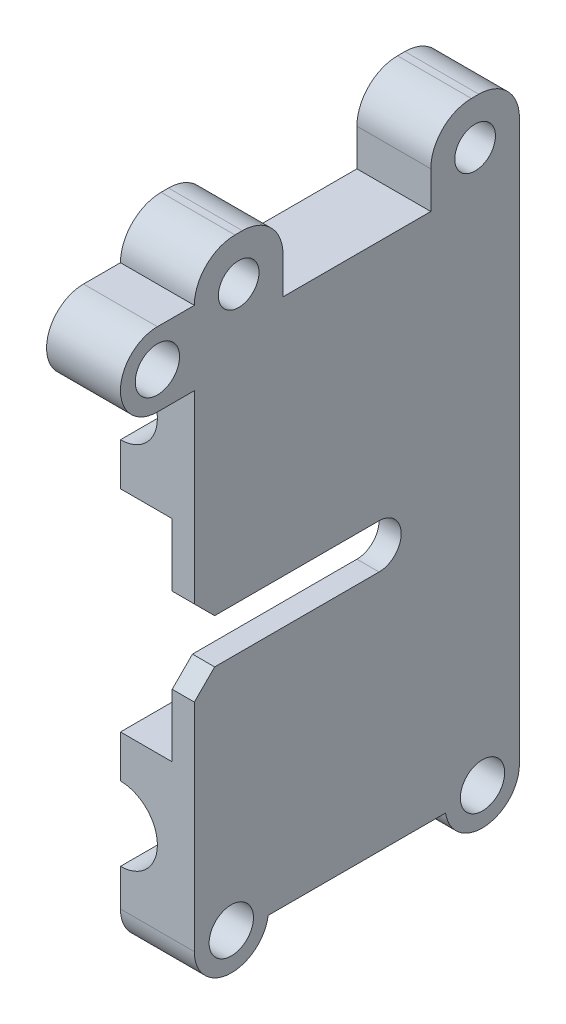
from build123d import *
from build123d.topology import SkipClean

# Parameters (mm, degrees)
SKETCH1_W                = 44
SKETCH1_H                = 32
BOSS_EXTRUDE1_DEPTH      = 12
SKETCH2_W                = 24.5
SKETCH2_H                = 15.5
CUT_EXTRUDE1_DEPTH       = 7.75
FILLET1_R                = 7.75
CUT_EXTRUDE2_DEPTH       = 40.661851949
CUT_EXTRUDE2_DEPTH_BACK  = 40.661851949
SKETCH4_R                = 2.75
SKETCH4_W                = 20
SKETCH4_H                = 10.5
CUT_EXTRUDE3_DEPTH       = 30.732137495
SKETCH5_W                = 5.5
SKETCH5_H                = 3
BOSS_EXTRUDE4_DEPTH      = 7
CHAMFER1_SIZE            = 7
SKETCH6_W                = 11.5
SKETCH6_H                = 7
CUT_EXTRUDE5_DEPTH       = 30.732137495
FILLET4_R                = 5.5
SKETCH10_W               = 3
SKETCH10_H               = 44
BOSS_EXTRUDE6_DEPTH      = 28.5
SKETCH11_W               = 10
SKETCH11_H               = 44
BOSS_EXTRUDE7_DEPTH      = 21.5
SKETCH12_W               = 24.5
SKETCH12_H               = 15.5
CUT_EXTRUDE8_DEPTH       = 7.75
FILLET6_R                = 7.75
CUT_EXTRUDE9_DEPTH       = 82.565924258
SKETCH14_W               = 16
SKETCH14_H               = 20
BOSS_EXTRUDE8_DEPTH      = 13.5
CUT_EXTRUDE10_DEPTH      = 10
FILLET7_R                = 2
SKETCH16_R               = 1.75
CUT_EXTRUDE11_DEPTH      = 72.275872496
CUT_EXTRUDE12_START      = -3
SKETCH17_R               = 1.75
CUT_EXTRUDE12_DEPTH      = 3
SKETCH18_W               = 44
SKETCH18_H               = 3
BOSS_EXTRUDE9_DEPTH      = 10
CUT_EXTRUDE13_REACH      = 76.096
SKETCH20_W               = 11
SKETCH20_H               = 9
SKETCH21_R               = 1.75
CUT_EXTRUDE14_DEPTH      = 5
SKETCH22_R               = 1.75
CUT_EXTRUDE15_DEPTH      = 2
SKETCH23_W               = 28
SKETCH23_H               = 6
CUT_EXTRUDE16_DEPTH      = 71.867834735
FILLET8_R                = 3
CHAMFER2_SIZE            = 2.75
CHAMFER3_SIZE            = 3
FILLET9_R                = 3
SKETCH25_W               = 10
SKETCH25_H               = 10
BOSS_EXTRUDE12_DEPTH     = 5
FILLET11_R               = 5
SKETCH26_W               = 10
SKETCH26_H               = 4.25
BOSS_EXTRUDE13_DEPTH     = 5
CUT_EXTRUDE17_DEPTH      = 80.498820746
CUT_EXTRUDE17_DEPTH_BACK = 80.498820746
SKETCH27_R               = 1.75
FILLET15_R               = 5
CUT_EXTRUDE20_DEPTH      = 80.498820746
CUT_EXTRUDE20_DEPTH_BACK = 80.498820746
SKETCH29_R               = 1.75
FILLET17_R               = 5.5
BOSS_EXTRUDE14_DEPTH     = 6
CHAMFER11_SIZE           = 7
SKETCH35_R               = 3
SKETCH35_R_2             = 1.75
CUT_EXTRUDE25_DEPTH      = 79.454206388
SKETCH36_W               = 132.801714395
SKETCH36_H               = 170.132581229
CUT_EXTRUDE26_DEPTH      = 79.938662897
CUT_EXTRUDE27_OUTLINE_R  = 1.75
CUT_EXTRUDE27_DEPTH      = 13.5
SKETCH38_W               = 16
SKETCH38_H               = 28.5
BOSS_EXTRUDE16_DEPTH     = 3
SKETCH39_R               = 1.75
BOSS_EXTRUDE18_DEPTH     = 5
CUT_EXTRUDE28_START      = -7
SKETCH40_R               = 3
SKETCH40_R_2             = 1.75
CUT_EXTRUDE28_DEPTH      = 7


# Read off the part's stored shape, not the designer's step: Cut-Extrude27
# Some blends are built 0.0001 mm under size
with BuildPart() as part:
    # Sketch1 → Boss-Extrude1 (new body)
    with BuildSketch(Plane(origin=(0, 0, 0), x_dir=(0, 0, -1), z_dir=(1, 0, 0))):
        Rectangle(SKETCH1_W, SKETCH1_H)
    extrude(amount=BOSS_EXTRUDE1_DEPTH)

    # Sketch2 → Cut-Extrude1 (cut)
    with BuildSketch(Plane(origin=(0, 0, 0), x_dir=(0, 0, -1), z_dir=(1, 0, 0))):
        with Locations((0, -5.25)):
            Rectangle(SKETCH2_W, SKETCH2_H)
    extrude(amount=CUT_EXTRUDE1_DEPTH, mode=Mode.SUBTRACT)

    # Fillet1
    fillet1_edges = [part.edges().sort_by_distance(p)[0] for p in [
        (7.75, 2.5, 0),
        (7.75, -13, 0),
    ]]
    fillet(fillet1_edges, radius=FILLET1_R - 0.0001)  # a hair under: the kernel refuses the full size

    # Sketch3 → Cut-Extrude2 (cut, two sides: drawn at the far end of the back side and taken through both)
    with BuildSketch(Plane.XY.offset(-12.25).offset(-CUT_EXTRUDE2_DEPTH_BACK)):
        with BuildLine():
            ThreePointArc((0, -10.25), (3.535533906, -8.785533906), (5, -5.25))
            ThreePointArc((5, -5.25), (3.535533906, -1.714466094), (0, -0.25))
            Line((0, -0.25), (0, -10.25))
        make_face()
        with BuildLine():
            Line((0, -10.25), (0, -0.25))
            ThreePointArc((0, -0.25), (-5, -5.25), (0, -10.25))
        make_face()
    extrude(amount=CUT_EXTRUDE2_DEPTH + CUT_EXTRUDE2_DEPTH_BACK, mode=Mode.SUBTRACT)

    # Sketch4 → Cut-Extrude3 (cut, through all)
    with BuildSketch(Plane(origin=(12, 0, 0), x_dir=(0, 0, -1), z_dir=(1, 0, 0))):
        with Locations((-16, 10)):
            Circle(SKETCH4_R)
        with Locations((16, 10)):
            Circle(SKETCH4_R)
        with Locations((0, 10.75)):
            Rectangle(SKETCH4_W, SKETCH4_H)
    extrude(amount=-CUT_EXTRUDE3_DEPTH, mode=Mode.SUBTRACT)

    # Sketch5 → Boss-Extrude4 (add)
    with BuildSketch(Plane(origin=(12, 0, 0), x_dir=(0, 0, -1), z_dir=(1, 0, 0))):
        Polygon((-16, -3), (-16, 4.5), (-2.75, -3), align=None)
        Polygon((-2.75, -3), (-16, 4.5), (-2.75, 0), align=None)
        with Locations((0, -1.5)):
            Rectangle(SKETCH5_W, SKETCH5_H)
        Polygon((2.75, -3), (2.75, 0), (16, 4.5), align=None)
        Polygon((16, -3), (2.75, -3), (16, 4.5), align=None)
    extrude(amount=BOSS_EXTRUDE4_DEPTH)

    # Chamfer1
    chamfer1_edges = [part.edges().sort_by_distance(p)[0] for p in [
        (12, -3, 0),
    ]]
    chamfer(chamfer1_edges, length=CHAMFER1_SIZE - 0.0001)  # a hair under: the kernel refuses the full size

    # Sketch6 → Cut-Extrude5 (cut, through all)
    with BuildSketch(Plane(origin=(12, 0, 0), x_dir=(0, 0, -1), z_dir=(1, 0, 0))):
        with Locations((-7.25, -6.5)):
            Rectangle(SKETCH6_W, SKETCH6_H)
        with Locations((7.25, -6.5)):
            Rectangle(SKETCH6_W, SKETCH6_H)
    extrude(amount=CUT_EXTRUDE5_DEPTH, mode=Mode.SUBTRACT)

    # Fillet4
    fillet4_edges = [part.edges().sort_by_distance(p)[0] for p in [
        (6, 16, 22),
        (6, 16, -22),
    ]]
    fillet(fillet4_edges, radius=FILLET4_R)

    # Sketch10 → Boss-Extrude6 (add)
    with BuildSketch(Plane.XZ.offset(16)):
        with Locations((8.5, 0)):
            Rectangle(SKETCH10_W, SKETCH10_H)
    extrude(amount=BOSS_EXTRUDE6_DEPTH)

    # Sketch11 → Boss-Extrude7 (add)
    with BuildSketch(Plane.XZ.offset(44.5)):
        with Locations((5, 0)):
            Rectangle(SKETCH11_W, SKETCH11_H)
    extrude(amount=BOSS_EXTRUDE7_DEPTH)

    # Sketch12 → Cut-Extrude8 (cut)
    with BuildSketch(Plane.ZY):
        with Locations((0, -55.25)):
            Rectangle(SKETCH12_W, SKETCH12_H)
    extrude(amount=-CUT_EXTRUDE8_DEPTH, mode=Mode.SUBTRACT)

    # Fillet6
    fillet6_edges = [part.edges().sort_by_distance(p)[0] for p in [
        (7.75, -63, 0),
        (7.75, -47.5, 0),
    ]]
    fillet(fillet6_edges, radius=FILLET6_R - 0.0001)  # a hair under: the kernel refuses the full size

    # Sketch13 → Cut-Extrude9 (cut, through all)
    with BuildSketch(Plane.XY.offset(22)):
        with BuildLine():
            ThreePointArc((0, -60.25), (3.535533906, -58.785533906), (5, -55.25))
            ThreePointArc((5, -55.25), (3.535533906, -51.714466094), (0, -50.25))
            Line((0, -50.25), (0, -60.25))
        make_face()
        with BuildLine():
            Line((0, -60.25), (0, -50.25))
            ThreePointArc((0, -50.25), (-5, -55.25), (0, -60.25))
        make_face()
    extrude(amount=-CUT_EXTRUDE9_DEPTH, mode=Mode.SUBTRACT)

    # Sketch14 → Boss-Extrude8 (add)
    with BuildSketch(Plane.ZY.offset(-7)):
        with Locations((-14, -26)):
            Rectangle(SKETCH14_W, SKETCH14_H)
    extrude(amount=BOSS_EXTRUDE8_DEPTH)

    # Sketch15 → Cut-Extrude10 (cut)
    with BuildSketch(Plane.ZY.offset(6.5)):
        with BuildLine():
            Line((-13.727178029, -29), (-22, -29))
            Line((-22, -29), (-22, -31.5))
            Line((-22, -31.5), (-13.727178029, -31.5))
            ThreePointArc((-13.727178029, -31.5), (-14, -30.25), (-13.727178029, -29))
        make_face()
        with BuildLine():
            ThreePointArc((-8, -30.25), (-10.360286817, -27.318998969), (-13.727178029, -29))
            Line((-13.727178029, -29), (-11, -29))
            Line((-11, -29), (-11, -31.5))
            Line((-11, -31.5), (-13.727178029, -31.5))
            ThreePointArc((-13.727178029, -31.5), (-10.360286817, -33.181001031), (-8, -30.25))
        make_face()
        with BuildLine():
            Line((-11, -29), (-13.727178029, -29))
            ThreePointArc((-13.727178029, -29), (-14, -30.25), (-13.727178029, -31.5))
            Line((-13.727178029, -31.5), (-11, -31.5))
            Line((-11, -31.5), (-11, -29))
        make_face()
    extrude(amount=-CUT_EXTRUDE10_DEPTH, mode=Mode.SUBTRACT)

    # Fillet7
    fillet7_edges = [part.edges().sort_by_distance(p)[0] for p in [
        (-1.5, -31.5, -13.727178029),
        (-1.5, -29, -13.727178029),
    ]]
    fillet(fillet7_edges, radius=FILLET7_R)

    # Sketch16 → Cut-Extrude11 (cut, through all)
    with BuildSketch(Plane.ZY.offset(-3.5)):
        with Locations((-11, -30.25)):
            Circle(SKETCH16_R)
    extrude(amount=-CUT_EXTRUDE11_DEPTH, mode=Mode.SUBTRACT)

    # Sketch17 → Cut-Extrude12 (cut)
    with BuildSketch(Plane(origin=(10, 0, 0), x_dir=(0, 0, -1), z_dir=(1, 0, 0)).offset(CUT_EXTRUDE12_START)):
        Polygon((14.175426481, -30.25), (12.58771324, -27.5), (9.41228676, -27.5), (7.824573519, -30.25), (9.41228676, -33), (12.58771324, -33), align=None)
        with Locations(Location((11, -30.25, 0), (0, 0, 180))):
            Circle(SKETCH17_R, mode=Mode.SUBTRACT)
    extrude(amount=CUT_EXTRUDE12_DEPTH, mode=Mode.SUBTRACT)

    # Sketch18 → Boss-Extrude9 (add)
    with BuildSketch(Plane.ZY.offset(-7)):
        with Locations((0, -37.5)):
            Rectangle(SKETCH18_W, SKETCH18_H)
    extrude(amount=BOSS_EXTRUDE9_DEPTH)

    # Cut-Extrude13: up to this face of the body (flat: up to its plane)
    cut_extrude13_end = Plane(part.part.faces().sort_by_distance((7, -26, 8))[0])
    # Sketch20 → Cut-Extrude13 (cut, up to the picked face)
    with BuildSketch(Plane.ZY.offset(6.5), mode=Mode.PRIVATE) as cut_extrude13_sk1:
        with Locations((-16.5, -20.5)):
            Rectangle(SKETCH20_W, SKETCH20_H)
    cut_extrude13_tool1 = split(extrude(cut_extrude13_sk1.sketch, amount=-CUT_EXTRUDE13_REACH, mode=Mode.PRIVATE), bisect_by=cut_extrude13_end, keep=Keep.BOTH, mode=Mode.PRIVATE)
    add(cut_extrude13_tool1.solids().sort_by(Axis((-6.5, -20.5, -16.5), (1, 0, 0)))[0], mode=Mode.SUBTRACT)

    # Sketch21 → Cut-Extrude14 (cut)
    with BuildSketch(Plane(origin=(0, 0, -11), x_dir=(-1, 0, 0), z_dir=(0, 0, -1))):
        with Locations(Location((0, -20.5, 0), (0, 0, 90))):
            Circle(SKETCH21_R)
    extrude(amount=-CUT_EXTRUDE14_DEPTH, mode=Mode.SUBTRACT)

    # Sketch22 → Cut-Extrude15 (cut)
    with BuildSketch(Plane(origin=(0, 0, -11), x_dir=(-1, 0, 0), z_dir=(0, 0, -1))):
        Polygon((3.175426481, -20.5), (1.58771324, -17.75), (-1.58771324, -17.75), (-3.175426481, -20.5), (-1.58771324, -23.25), (1.58771324, -23.25), align=None)
        with Locations(Location((0, -20.5, 0), (0, 0, 90))):
            Circle(SKETCH22_R, mode=Mode.SUBTRACT)
    extrude(amount=-CUT_EXTRUDE15_DEPTH, mode=Mode.SUBTRACT)

    # Sketch23 → Cut-Extrude16 (cut, through all)
    with BuildSketch(Plane.ZY.offset(-7)):
        with Locations((8, -30.25)):
            Rectangle(SKETCH23_W, SKETCH23_H)
    extrude(amount=-CUT_EXTRUDE16_DEPTH, mode=Mode.SUBTRACT)

    # Fillet8
    fillet8_edges = [part.edges().sort_by_distance(p)[0] for p in [
        (8.5, -27.25, -6),
        (8.5, -33.25, -6),
    ]]
    fillet(fillet8_edges, radius=FILLET8_R - 0.0001)  # a hair under: the kernel refuses the full size

    # Chamfer2
    chamfer2_edges = [part.edges().sort_by_distance(p)[0] for p in [
        (8.5, -27.25, 22),
        (8.5, -33.25, 22),
    ]]
    chamfer(chamfer2_edges, length=CHAMFER2_SIZE)

    # Chamfer3
    # the kernel refuses this chamfer: 3 mm, written as the material it adds along each edge
    with BuildSketch(Plane(origin=(-6.5, -25, -11), x_dir=(0, -0.02749587661058678, -0.9996219169112968), z_dir=(1, 0, 0))) as chamfer3_piece_1_section:
        Polygon((CHAMFER3_SIZE * 0.999621916911, CHAMFER3_SIZE * 0.0274958766106), (-CHAMFER3_SIZE * 0.0274958766106, CHAMFER3_SIZE * 0.999621916911), (0, 0), align=None)
    chamfer3_piece_1 = extrude(amount=13.5, mode=Mode.PRIVATE)
    chamfer3_piece_1 = split(chamfer3_piece_1, bisect_by=Plane(origin=(-3.73666725, -23.25, -12.148979941), z_dir=(0, -1, 0)), keep=Keep.TOP, mode=Mode.PRIVATE)
    chamfer3_piece_1 = split(chamfer3_piece_1, bisect_by=Plane(origin=(-1.664167688, -23.117577012, -12.148979941), z_dir=(-0.8660254037844387, -0.5, 0)), keep=Keep.TOP, mode=Mode.PRIVATE)
    add(chamfer3_piece_1)
    with BuildSketch(Plane(origin=(-6.5, -25, -11), x_dir=(0, -0.02749587661058678, -0.9996219169112968), z_dir=(1, 0, 0))) as chamfer3_piece_2_section:
        Polygon((CHAMFER3_SIZE * 0.999621916911, CHAMFER3_SIZE * 0.0274958766106), (-CHAMFER3_SIZE * 0.0274958766106, CHAMFER3_SIZE * 0.999621916911), (0, 0), align=None)
    chamfer3_piece_2 = extrude(amount=13.5, mode=Mode.PRIVATE)
    chamfer3_piece_2 = split(chamfer3_piece_2, bisect_by=Plane(origin=(-4.173603854, -23.25, -11.356465756), z_dir=(0, 1, 0)), keep=Keep.TOP, mode=Mode.PRIVATE)
    chamfer3_piece_2 = split(chamfer3_piece_2, bisect_by=Plane(origin=(-2.428806744, -21.793183317, -11.356465756), z_dir=(-0.8660254037844387, -0.5, 0)), keep=Keep.TOP, mode=Mode.PRIVATE)
    add(chamfer3_piece_2)
    with BuildSketch(Plane(origin=(-6.5, -25, -11), x_dir=(0, -0.02749587661058678, -0.9996219169112968), z_dir=(1, 0, 0))) as chamfer3_piece_3_section:
        Polygon((CHAMFER3_SIZE * 0.999621916911, CHAMFER3_SIZE * 0.0274958766106), (-CHAMFER3_SIZE * 0.0274958766106, CHAMFER3_SIZE * 0.999621916911), (0, 0), align=None)
    chamfer3_piece_3 = extrude(amount=13.5, mode=Mode.PRIVATE)
    chamfer3_piece_3 = split(chamfer3_piece_3, bisect_by=Plane(origin=(0.808235084, -24.600095769, -12.048987561), z_dir=(-0.8660254037844387, 0.5, 0)), keep=Keep.TOP, mode=Mode.PRIVATE)
    chamfer3_piece_3 = split(chamfer3_piece_3, bisect_by=Plane(origin=(0, -23.25, -12.048987561), z_dir=(0, -1, 0)), keep=Keep.TOP, mode=Mode.PRIVATE)
    chamfer3_piece_3 = split(chamfer3_piece_3, bisect_by=Plane(origin=(-0.808235084, -24.600095769, -12.048987561), z_dir=(0.8660254037844387, 0.5, 0)), keep=Keep.TOP, mode=Mode.PRIVATE)
    add(chamfer3_piece_3)
    with BuildSketch(Plane(origin=(-6.5, -25, -11), x_dir=(0, -0.02749587661058678, -0.9996219169112968), z_dir=(1, 0, 0))) as chamfer3_piece_4_section:
        Polygon((CHAMFER3_SIZE * 0.999621916911, CHAMFER3_SIZE * 0.0274958766106), (-CHAMFER3_SIZE * 0.0274958766106, CHAMFER3_SIZE * 0.999621916911), (0, 0), align=None)
    chamfer3_piece_4 = extrude(amount=13.5, mode=Mode.PRIVATE)
    chamfer3_piece_4 = split(chamfer3_piece_4, bisect_by=Plane(origin=(1.727823153, -23.007322513, -12.147714097), z_dir=(0.8660254037844387, -0.5, 0)), keep=Keep.TOP, mode=Mode.PRIVATE)
    chamfer3_piece_4 = split(chamfer3_piece_4, bisect_by=Plane(origin=(3.987327516, -23.25, -12.147714097), z_dir=(0, -1, 0)), keep=Keep.TOP, mode=Mode.PRIVATE)
    add(chamfer3_piece_4)
    with BuildSketch(Plane(origin=(-6.5, -25, -11), x_dir=(0, -0.02749587661058678, -0.9996219169112968), z_dir=(1, 0, 0))) as chamfer3_piece_5_section:
        Polygon((CHAMFER3_SIZE * 0.999621916911, CHAMFER3_SIZE * 0.0274958766106), (-CHAMFER3_SIZE * 0.0274958766106, CHAMFER3_SIZE * 0.999621916911), (0, 0), align=None)
    chamfer3_piece_5 = extrude(amount=13.5, mode=Mode.PRIVATE)
    chamfer3_piece_5 = split(chamfer3_piece_5, bisect_by=Plane(origin=(2.491960026, -21.683798625, -11.355783828), z_dir=(0.8660254037844387, -0.5, 0)), keep=Keep.TOP, mode=Mode.PRIVATE)
    chamfer3_piece_5 = split(chamfer3_piece_5, bisect_by=Plane(origin=(4.423977158, -23.25, -11.355783828), z_dir=(0, 1, 0)), keep=Keep.TOP, mode=Mode.PRIVATE)
    add(chamfer3_piece_5)

    # Fillet9
    fillet9_edges = [part.edges().sort_by_distance(p)[0] for p in [
        (-6.5, -16, -8.5),
    ]]
    fillet(fillet9_edges, radius=FILLET9_R)

    # Sketch25 → Boss-Extrude12 (add)
    with BuildSketch(Plane.ZY):
        with Locations((27, 5.5)):
            Rectangle(SKETCH25_W, SKETCH25_H)
    extrude(amount=-BOSS_EXTRUDE12_DEPTH)

    # Fillet11
    fillet11_edges = [part.edges().sort_by_distance(p)[0] for p in [
        (2.5, 0.5, 32),
        (2.5, 10.5, 32),
    ]]
    fillet(fillet11_edges, radius=FILLET11_R - 0.0001)  # a hair under: the kernel refuses the full size

    # Sketch26 → Boss-Extrude13 (add)
    with BuildSketch(Plane.ZY):
        with Locations((-17, -68.125)):
            Rectangle(SKETCH26_W, SKETCH26_H)
        with Locations((17, -68.125)):
            Rectangle(SKETCH26_W, SKETCH26_H)
    extrude(amount=-BOSS_EXTRUDE13_DEPTH)

    # Sketch27 → Cut-Extrude17 (cut, two sides: drawn at the far end of the back side and taken through both)
    with BuildSketch(Plane.ZY.offset(-CUT_EXTRUDE17_DEPTH_BACK)):
        with Locations(Location((-17, -65.25, 0), (0, 0, 334.623066475))):
            Circle(SKETCH27_R)
        with Locations(Location((17, -65.25, 0), (0, 0, 334.623066475))):
            Circle(SKETCH27_R)
    extrude(amount=CUT_EXTRUDE17_DEPTH + CUT_EXTRUDE17_DEPTH_BACK, mode=Mode.SUBTRACT)

    # Fillet15
    # the kernel refuses this fillet: 5 mm, written as the material it takes off along each edge
    with BuildSketch(Plane(origin=(-12.358574958, -70.25, 12), x_dir=(0, 1, 0), z_dir=(1, 0, 0))) as fillet15_piece_1:
        with BuildLine():
            CenterArc((5, 4.943429983), FILLET15_R, 180, 81.373073441)
            Line((0, 4.943429983), (-0.1, 4.943429983))
            Line((-0.1, 4.943429983), (-0.1, 0))
            Line((-0.1, 0), (0, -0.1))
            ThreePointArc((0, -0.1), (2.125, -0.1), (4.235, -0.0988686))
            Line((4.235, -0.0988686), (4.25, 0))
        make_face()
    extrude(amount=29.717149917, mode=Mode.SUBTRACT)
    with BuildSketch(Plane(origin=(-12.358574958, -70.25, -12), x_dir=(0, 0, -1), z_dir=(1, 0, 0))) as fillet15_piece_2:
        with BuildLine():
            CenterArc((4.943429983, 5), FILLET15_R, 188.626926559, 81.373073441)
            Line((0, 4.25), (-0.0988686, 4.235))
            ThreePointArc((-0.0988686, 4.235), (-0.1, 2.125), (-0.1, 0))
            Line((-0.1, 0), (0, -0.1))
            Line((0, -0.1), (4.943429983, -0.1))
            Line((4.943429983, -0.1), (4.943429983, 0))
        make_face()
    extrude(amount=29.717149917, mode=Mode.SUBTRACT)
    with BuildSketch(Plane(origin=(-12.5, -70.25, -22), x_dir=(0, 1, 0), z_dir=(1, 0, 0))) as fillet15_piece_3:
        with BuildLine():
            CenterArc((FILLET15_R, FILLET15_R), FILLET15_R, 180, 90)
            Line((0, FILLET15_R), (-FILLET15_R * 0.02, FILLET15_R))
            Line((-FILLET15_R * 0.02, FILLET15_R), (-FILLET15_R * 0.02, -FILLET15_R * 0.02))
            Line((-FILLET15_R * 0.02, -FILLET15_R * 0.02), (FILLET15_R, -FILLET15_R * 0.02))
            Line((FILLET15_R, -FILLET15_R * 0.02), (FILLET15_R, 0))
        make_face()
    extrude(amount=30, mode=Mode.SUBTRACT)
    with BuildSketch(Plane(origin=(-12.5, -70.25, 22), x_dir=(0, 1, 0), z_dir=(1, 0, 0))) as fillet15_piece_4:
        with BuildLine():
            CenterArc((FILLET15_R, -FILLET15_R), FILLET15_R, 90, 90)
            Line((0, -FILLET15_R), (-FILLET15_R * 0.02, -FILLET15_R))
            Line((-FILLET15_R * 0.02, -FILLET15_R), (-FILLET15_R * 0.02, FILLET15_R * 0.02))
            Line((-FILLET15_R * 0.02, FILLET15_R * 0.02), (FILLET15_R, FILLET15_R * 0.02))
            Line((FILLET15_R, FILLET15_R * 0.02), (FILLET15_R, 0))
        make_face()
    extrude(amount=30, mode=Mode.SUBTRACT)

    # Sketch29 → Cut-Extrude20 (cut, two sides: drawn at the far end of the back side and taken through both)
    with BuildSketch(Plane.ZY.offset(-CUT_EXTRUDE20_DEPTH_BACK)):
        with Locations((27, 5.5)):
            Circle(SKETCH29_R)
    extrude(amount=CUT_EXTRUDE20_DEPTH + CUT_EXTRUDE20_DEPTH_BACK, mode=Mode.SUBTRACT)

    # Fillet17
    fillet17_edges = [part.edges().sort_by_distance(p)[0] for p in [
        (6, 16, 10),
        (6, 16, -10),
    ]]
    fillet(fillet17_edges, radius=FILLET17_R)

    # Sketch32 → Boss-Extrude14 (add)
    with SkipClean():  # the faces are left unmerged after this step: merging them gives an invalid solid
        with BuildSketch(Plane(origin=(0, 0, -16), x_dir=(-1, 0, 0), z_dir=(0, 0, -1))):
            Polygon((-12, -10), (-12, 4.5), (-19, 4.5), (-19, -3), align=None)
        extrude(amount=BOSS_EXTRUDE14_DEPTH)

    # Chamfer11
    chamfer11_edges = [part.edges().sort_by_distance(p)[0] for p in [
        (15.49995, -3, 13),
    ]]
    chamfer(chamfer11_edges, length=CHAMFER11_SIZE - 0.0004)  # a hair under: the kernel refuses the full size
    chamfer11_2_edges = [part.edges().sort_by_distance(p)[0] for p in [
        (15.49995, -3, -1.5),
    ]]
    chamfer(chamfer11_2_edges, length=CHAMFER11_SIZE - 0.0004)  # a hair under: the kernel refuses the full size

    # Sketch35 → Cut-Extrude25 (cut, through all)
    # profile 1 of 3: a face of its own
    with SkipClean():  # the faces are left unmerged after this step: merging them gives an invalid solid
        with BuildSketch(Plane(origin=(5, 0, 0), x_dir=(0, 0, -1), z_dir=(1, 0, 0))):
            with Locations((-27, 5.5)):
                Circle(SKETCH35_R)
            with Locations(Location((-27, 5.5, 0), (0, 0, 180))):
                Circle(SKETCH35_R_2, mode=Mode.SUBTRACT)
        # profile 2 of 3: a face of its own
        with BuildSketch(Plane(origin=(5, 0, 0), x_dir=(0, 0, -1), z_dir=(1, 0, 0))):
            with Locations((-17, -65.25)):
                Circle(SKETCH35_R)
            with Locations(Location((-17, -65.25, 0), (0, 0, 180))):
                Circle(SKETCH35_R_2, mode=Mode.SUBTRACT)
        # profile 3 of 3: a face of its own
        with BuildSketch(Plane(origin=(5, 0, 0), x_dir=(0, 0, -1), z_dir=(1, 0, 0))):
            with Locations((17, -65.25)):
                Circle(SKETCH35_R)
            with Locations(Location((17, -65.25, 0), (0, 0, 180))):
                Circle(SKETCH35_R_2, mode=Mode.SUBTRACT)
        extrude(amount=CUT_EXTRUDE25_DEPTH, mode=Mode.SUBTRACT)

    # Sketch36 → Cut-Extrude26 (cut, through all)
    with BuildSketch(Plane(origin=(10, 0, 0), x_dir=(0, 0, -1), z_dir=(1, 0, 0))):
        with Locations((-1.437867423, -36.624230017)):
            Rectangle(SKETCH36_W, SKETCH36_H)
    extrude(amount=CUT_EXTRUDE26_DEPTH, mode=Mode.SUBTRACT)

    # Cut-Extrude27 outline → Cut-Extrude27 (cut)
    with BuildSketch(Plane.ZY.offset(-7)):
        Polygon((-6, -36), (-6, -16), (-11, -16), (-11, -22), (-14, -25), (-22, -25), (-22, -39), (22, -39), (22, -36), align=None)
        with Locations((-11, -30.25)):
            Circle(CUT_EXTRUDE27_OUTLINE_R, mode=Mode.SUBTRACT)
    extrude(amount=CUT_EXTRUDE27_DEPTH, mode=Mode.SUBTRACT)

    # Sketch38 → Boss-Extrude16 (add)
    with BuildSketch(Plane.ZY.offset(-7)):
        with Locations((-14, -30.25)):
            Rectangle(SKETCH38_W, SKETCH38_H)
    extrude(amount=-BOSS_EXTRUDE16_DEPTH)

    # Sketch39 → Boss-Extrude18 (add)
    # profile 1 of 3: a face of its own
    with BuildSketch(Plane(origin=(5, 0, 0), x_dir=(0, 0, -1), z_dir=(1, 0, 0))):
        with BuildLine():
            Line((-27, 0.5), (-22, 0.5))
            Line((-22, 0.5), (-22, 10.5))
            Line((-22, 10.5), (-27, 10.5))
            ThreePointArc((-27, 10.5), (-30.535533906, 9.035533906), (-32, 5.5))
            ThreePointArc((-32, 5.5), (-30.535533906, 1.964466094), (-27, 0.5))
        make_face()
        with Locations(Location((-27, 5.5, 0), (0, 0, 180))):
            Circle(SKETCH39_R, mode=Mode.SUBTRACT)
    # profile 2 of 3: a face of its own
    with BuildSketch(Plane(origin=(5, 0, 0), x_dir=(0, 0, -1), z_dir=(1, 0, 0))):
        with BuildLine():
            Line((14.09526249, -66), (12, -66))
            ThreePointArc((12, -66), (13.683828781, -69.041437722), (16.943429983, -70.25))
            Line((16.943429983, -70.25), (17, -70.25))
            ThreePointArc((17, -70.25), (20.259601203, -69.041437722), (21.943429983, -66))
            Line((21.943429983, -66), (19.90473751, -66))
            ThreePointArc((19.90473751, -66), (17, -62.25), (14.09526249, -66))
        make_face()
        with Locations(Location((17, -65.25, 0), (0, 0, 180))):
            Circle(SKETCH39_R, mode=Mode.SUBTRACT)
    # profile 3 of 3: a face of its own
    with BuildSketch(Plane(origin=(5, 0, 0), x_dir=(0, 0, -1), z_dir=(1, 0, 0))):
        with BuildLine():
            Line((-12, -66), (-14.09526249, -66))
            ThreePointArc((-14.09526249, -66), (-17, -62.25), (-19.90473751, -66))
            Line((-19.90473751, -66), (-21.943429983, -66))
            ThreePointArc((-21.943429983, -66), (-20.259601203, -69.041437722), (-17, -70.25))
            Line((-17, -70.25), (-16.943429983, -70.25))
            ThreePointArc((-16.943429983, -70.25), (-13.683828781, -69.041437722), (-12, -66))
        make_face()
        with Locations(Location((-17, -65.25, 0), (0, 0, 180))):
            Circle(SKETCH39_R, mode=Mode.SUBTRACT)
    extrude(amount=BOSS_EXTRUDE18_DEPTH)

    # Sketch40 → Cut-Extrude28 (cut)
    # profile 1 of 3: a face of its own
    with BuildSketch(Plane(origin=(10, 0, 0), x_dir=(0, 0, -1), z_dir=(1, 0, 0)).offset(CUT_EXTRUDE28_START)):
        with Locations((-27, 5.5)):
            Circle(SKETCH40_R)
        with Locations(Location((-27, 5.5, 0), (0, 0, 180))):
            Circle(SKETCH40_R_2, mode=Mode.SUBTRACT)
    # profile 2 of 3: a face of its own
    with BuildSketch(Plane(origin=(10, 0, 0), x_dir=(0, 0, -1), z_dir=(1, 0, 0)).offset(CUT_EXTRUDE28_START)):
        with Locations((-17, -65.25)):
            Circle(SKETCH40_R)
        with Locations((-17, -65.25)):
            Circle(SKETCH40_R_2, mode=Mode.SUBTRACT)
    # profile 3 of 3: a face of its own
    with BuildSketch(Plane(origin=(10, 0, 0), x_dir=(0, 0, -1), z_dir=(1, 0, 0)).offset(CUT_EXTRUDE28_START)):
        with Locations((17, -65.25)):
            Circle(SKETCH40_R)
        with Locations((17, -65.25)):
            Circle(SKETCH40_R_2, mode=Mode.SUBTRACT)
    extrude(amount=CUT_EXTRUDE28_DEPTH, mode=Mode.SUBTRACT)


solid = part.part
